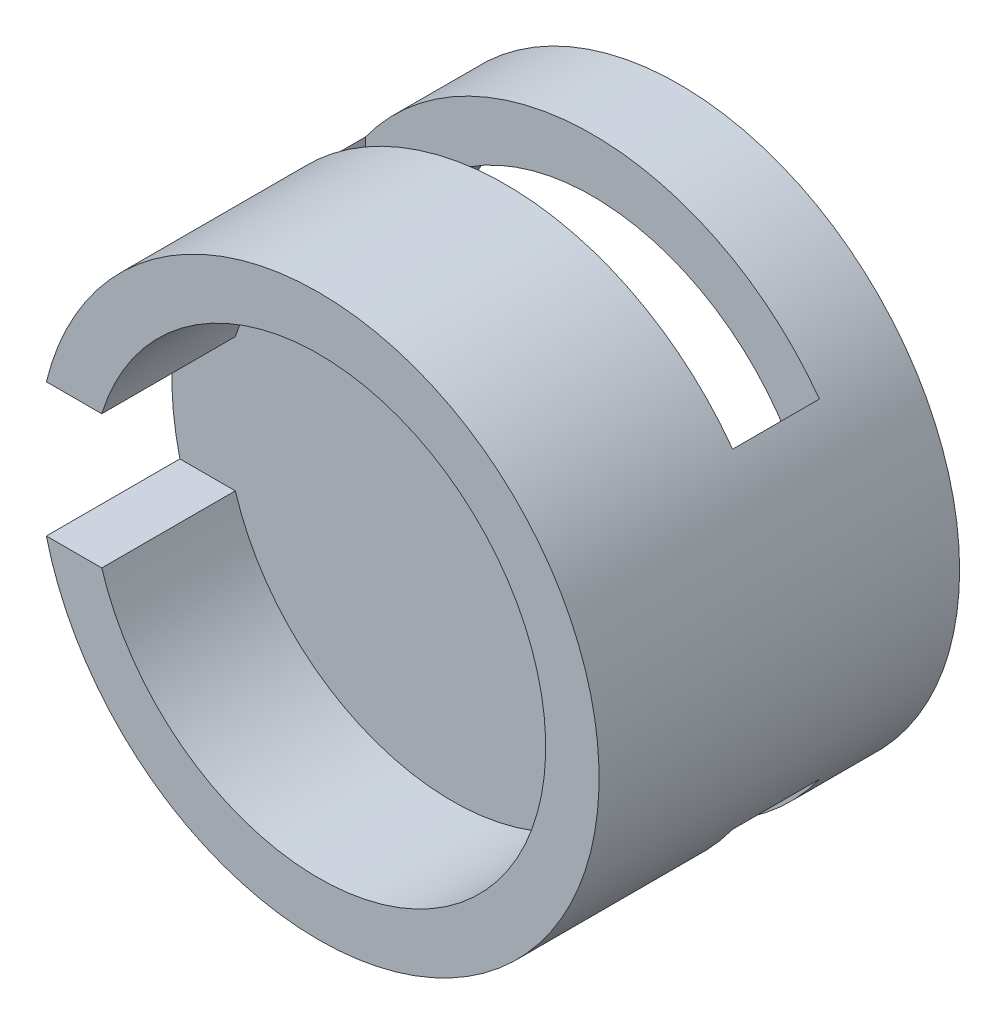
from build123d import *
from build123d.topology import SkipClean

# Parameters (mm, degrees)
ESBO_O1_R                  = 21
ESBO_O1_R_2                = 17
RESSALTO_EXTRUS_O1_DEPTH   = 10
RESSALTO_EXTRUS_O2_START   = 4
ESBO_O2_R                  = 21
RESSALTO_EXTRUS_O2_DEPTH   = 4
ESBO_O3_W                  = 15.703263836
ESBO_O3_H                  = 10
CORTE_EXTRUS_O1_DEPTH      = 10
RESSALTO_EXTRUS_O4_START   = -17
ESBO_O8_R                  = 21
ESBO_O8_R_2                = 17
RESSALTO_EXTRUS_O4_DEPTH   = 17
CORTE_EXTRUS_O3_DEPTH      = 27
CORTE_EXTRUS_O3_DEPTH_BACK = 27
ESBO_O12_W                 = 34
ESBO_O12_H                 = 6.5


with BuildPart() as part:
    # Esboço1 → Ressalto-extrusão1 (new body)
    with BuildSketch(Plane.XY):
        Circle(ESBO_O1_R)
        Circle(ESBO_O1_R_2, mode=Mode.SUBTRACT)
    extrude(amount=RESSALTO_EXTRUS_O1_DEPTH)

    # Esboço2 → Ressalto-extrusão2 (add)
    with BuildSketch(Plane(origin=(0, 0, 0), x_dir=(-1, 0, 0), z_dir=(0, 0, -1)).offset(RESSALTO_EXTRUS_O2_START)):
        Circle(ESBO_O2_R)
    extrude(amount=-RESSALTO_EXTRUS_O2_DEPTH)

    # Esboço3 → Corte-extrusão1 (cut)
    with SkipClean():  # the faces are left unmerged after this step: merging them gives an invalid solid
        with BuildSketch(Plane.XY.offset(10)):
            with Locations((-21, 0)):
                Rectangle(ESBO_O3_W, ESBO_O3_H)
        extrude(amount=-CORTE_EXTRUS_O1_DEPTH, mode=Mode.SUBTRACT)

    # Esboço8 → Ressalto-extrusão4 (add)
    with SkipClean():  # the faces are left unmerged after this step: merging them gives an invalid solid
        with BuildSketch(Plane.XY.offset(RESSALTO_EXTRUS_O4_START)):
            with Locations(Location((0, 0, 0), (0, 0, 193.774146998))):
                Circle(ESBO_O8_R)
            Circle(ESBO_O8_R_2, mode=Mode.SUBTRACT)
        extrude(amount=RESSALTO_EXTRUS_O4_DEPTH)
    add(part.part.scale(1), mode=Mode.REPLACE)  # the faces are merged on a copy

    # Esboço12 → Corte-extrusão3 (cut, two sides: drawn at the far end of the back side and taken through both)
    with BuildSketch(Plane(origin=(0, 0, 0), x_dir=(1, 0, 0), z_dir=(0, 1, 0)).offset(-CORTE_EXTRUS_O3_DEPTH_BACK)):
        with Locations((0, 7.25)):
            Rectangle(ESBO_O12_W, ESBO_O12_H)
    extrude(amount=CORTE_EXTRUS_O3_DEPTH + CORTE_EXTRUS_O3_DEPTH_BACK, mode=Mode.SUBTRACT)


solid = part.part
